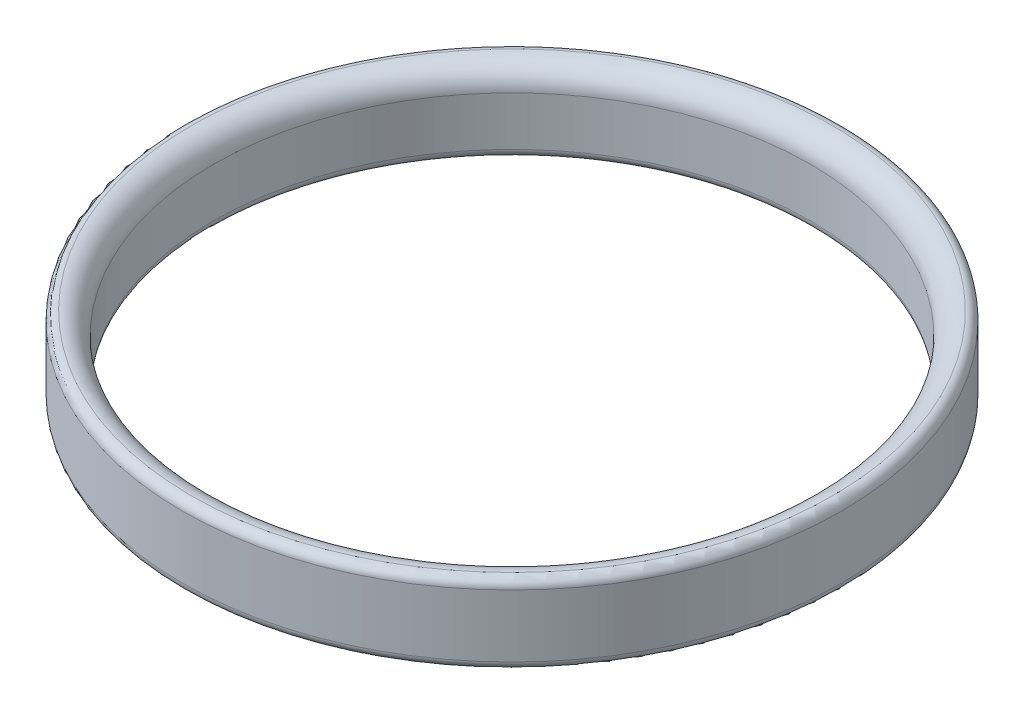
from build123d import *

# Parameters (mm, degrees)
SKETCH1_R           = 7.4
SKETCH1_R_2         = 6.7
BOSS_EXTRUDE1_DEPTH = 1.8
FILLET1_R           = 0.5
FILLET2_R           = 0.2


with BuildPart() as part:
    # Sketch1 → Boss-Extrude1 (new body)
    with BuildSketch(Plane(origin=(0, 0, 0), x_dir=(1, 0, 0), z_dir=(0, 1, 0))):
        with Locations(Location((0, 0, 0), (0, 0, 270))):
            Circle(SKETCH1_R)
        with Locations(Location((0, 0, 0), (0, 0, 270))):
            Circle(SKETCH1_R_2, mode=Mode.SUBTRACT)
    extrude(amount=BOSS_EXTRUDE1_DEPTH)

    # Fillet1
    fillet1_edges = [part.edges().sort_by_distance(p)[0] for p in [
        (0, 1.8, -6.7),
    ]]
    fillet(fillet1_edges, radius=FILLET1_R)

    # Fillet2
    fillet2_edges = [part.edges().sort_by_distance(p)[0] for p in [
        (0, 0, -7.4),
        (0, 1.8, -7.4),
        (0, 0, -6.7),
    ]]
    fillet(fillet2_edges, radius=FILLET2_R - 0.0001)  # a hair under: the kernel refuses the full size


solid = part.part
